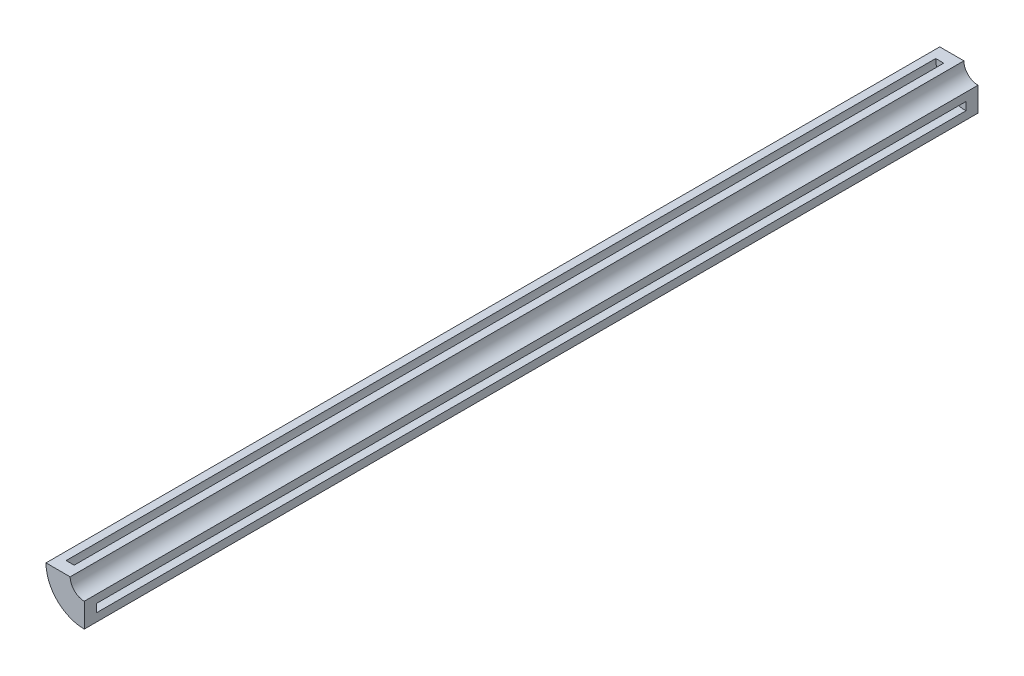
from build123d import *

# Parameters (mm, degrees)
BOSS_EXTRUDE1_DEPTH   = 215.9
BOSS_EXTRUDE1_2_DEPTH = 215.9
BOSS_EXTRUDE2_DEPTH   = 3
BOSS_EXTRUDE3_START   = 3
BOSS_EXTRUDE3_DEPTH   = 3


with BuildPart() as part:
    # Sketch1 → Boss-Extrude1 (new body)
    with BuildSketch(Plane.XY):
        with BuildLine():
            Line((0, -3.5), (0, -5.5))
            ThreePointArc((0, -5.5), (-3.889087297, -3.889087297), (-5.5, 0))
            Line((-5.5, 0), (-3.5, 0))
            ThreePointArc((-3.5, 0), (-2.474873734, -2.474873734), (0, -3.5))
        make_face()
    extrude(amount=BOSS_EXTRUDE1_DEPTH)



with BuildPart() as body_2:
    # Sketch1 → Boss-Extrude1 2 (new body)
    with BuildSketch(Plane.XY):
        with BuildLine():
            Line((-7.5, 0), (-9.5, 0))
            ThreePointArc((-9.5, 0), (-6.717514421, -6.717514421), (0, -9.5))
            Line((0, -9.5), (0, -7.5))
            ThreePointArc((0, -7.5), (-5.303300859, -5.303300859), (-7.5, 0))
        make_face()
    extrude(amount=BOSS_EXTRUDE1_2_DEPTH)


with BuildPart() as part_1:
    add(part.part)

    add(body_2.part)  # Boss-Extrude2 merges body 2
    # Sketch2 → Boss-Extrude2 (add)
    with BuildSketch(Plane.XY.offset(215.9)):
        with BuildLine():
            Line((-3.5, 0), (-9.5, 0))
            ThreePointArc((-9.5, 0), (-6.717514421, -6.717514421), (0, -9.5))
            Line((0, -9.5), (0, -3.5))
            ThreePointArc((0, -3.5), (-2.474873734, -2.474873734), (-3.5, 0))
        make_face()
    extrude(amount=BOSS_EXTRUDE2_DEPTH)

    # Sketch3 → Boss-Extrude3 (add)
    with BuildSketch(Plane(origin=(0, 0, 0), x_dir=(-1, 0, 0), z_dir=(0, 0, -1)).offset(BOSS_EXTRUDE3_START)):
        with BuildLine():
            Line((3.5, 0), (9.5, 0))
            ThreePointArc((9.5, 0), (6.717514421, -6.717514421), (0, -9.5))
            Line((0, -9.5), (0, -3.5))
            ThreePointArc((0, -3.5), (2.474873734, -2.474873734), (3.5, 0))
        make_face()
    extrude(amount=-BOSS_EXTRUDE3_DEPTH)


solid = part_1.part
